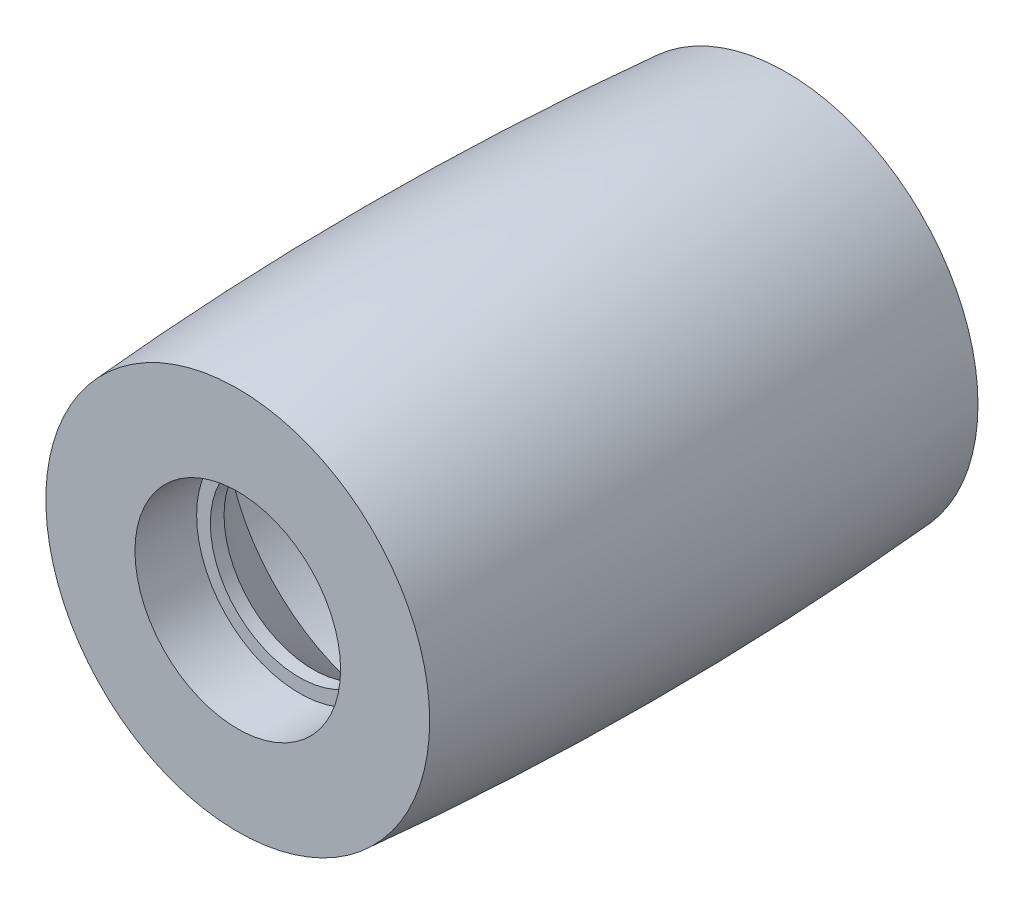
from build123d import *


with BuildPart() as part:
    # Skizze1 → Rotation1 (revolve)
    with BuildSketch(Plane.ZY.offset(-440)):
        with BuildLine():
            Line((-19, 15), (-10, 15))
            Line((-10, 15), (-10, 28))
            ThreePointArc((-10, 28), (-29.98594244, 29.124868257), (-50, 29.5))
            Line((-50, 29.5), (-50, 26))
            Line((-50, 26), (-34, 26))
            Line((-34, 26), (-21, 13))
            Line((-21, 13), (-19, 13))
            Line((-19, 13), (-19, 15))
        make_face()
    revolve(axis=Axis((440, 0, 0), (0, 0, -1)))

    # Spiegeln1: part across plane


with BuildPart() as part_1:
    add(part.part)
    add(part.part.mirror(Plane(origin=(440, 29.5, -50), x_dir=(1, 0, 0), z_dir=(0, 0, -1))))


solid = part_1.part
